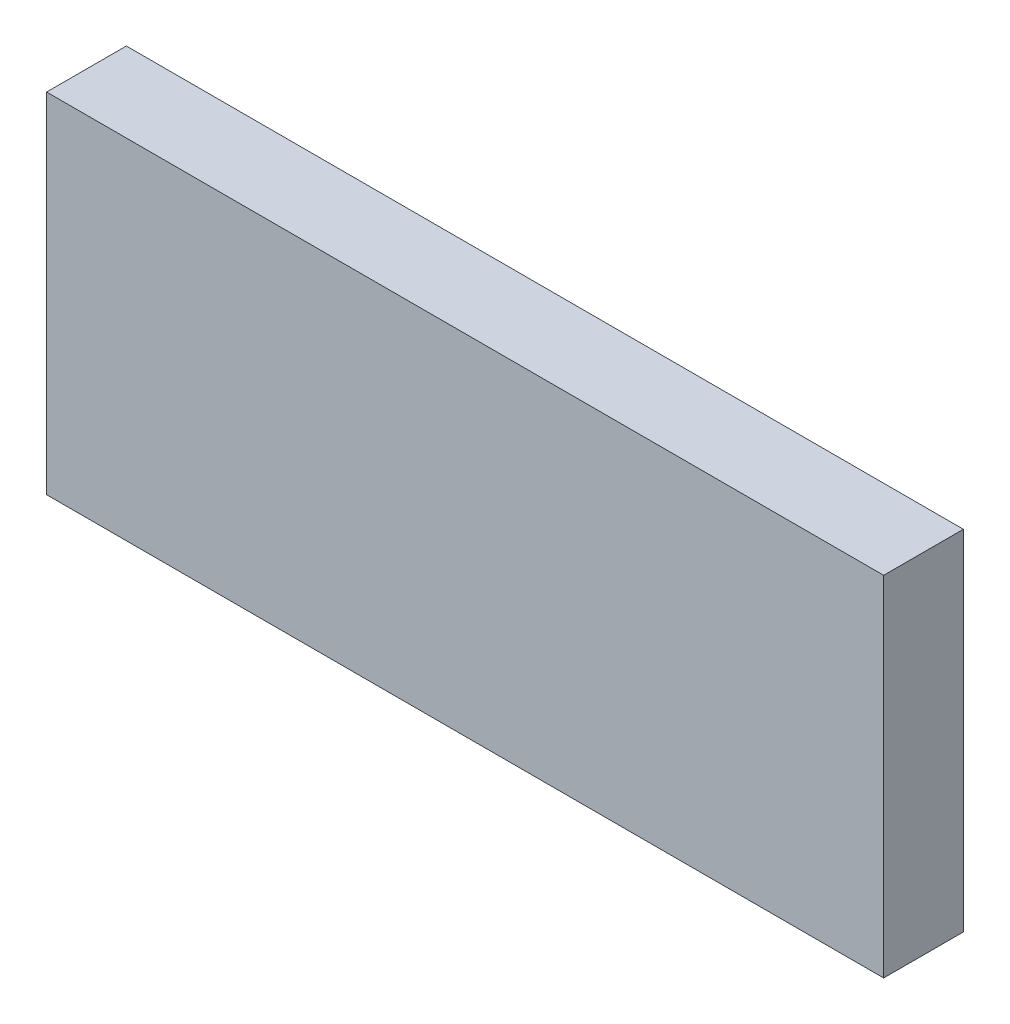
from build123d import *

# Parameters (mm, degrees)
SKETCH1_W           = 168
SKETCH1_H           = 70
BOSS_EXTRUDE1_DEPTH = 16


with BuildPart() as part:
    # Sketch1 → Boss-Extrude1 (new body)
    with BuildSketch(Plane.XY):
        with Locations((84, 35)):
            Rectangle(SKETCH1_W, SKETCH1_H)
    extrude(amount=BOSS_EXTRUDE1_DEPTH)


solid = part.part
